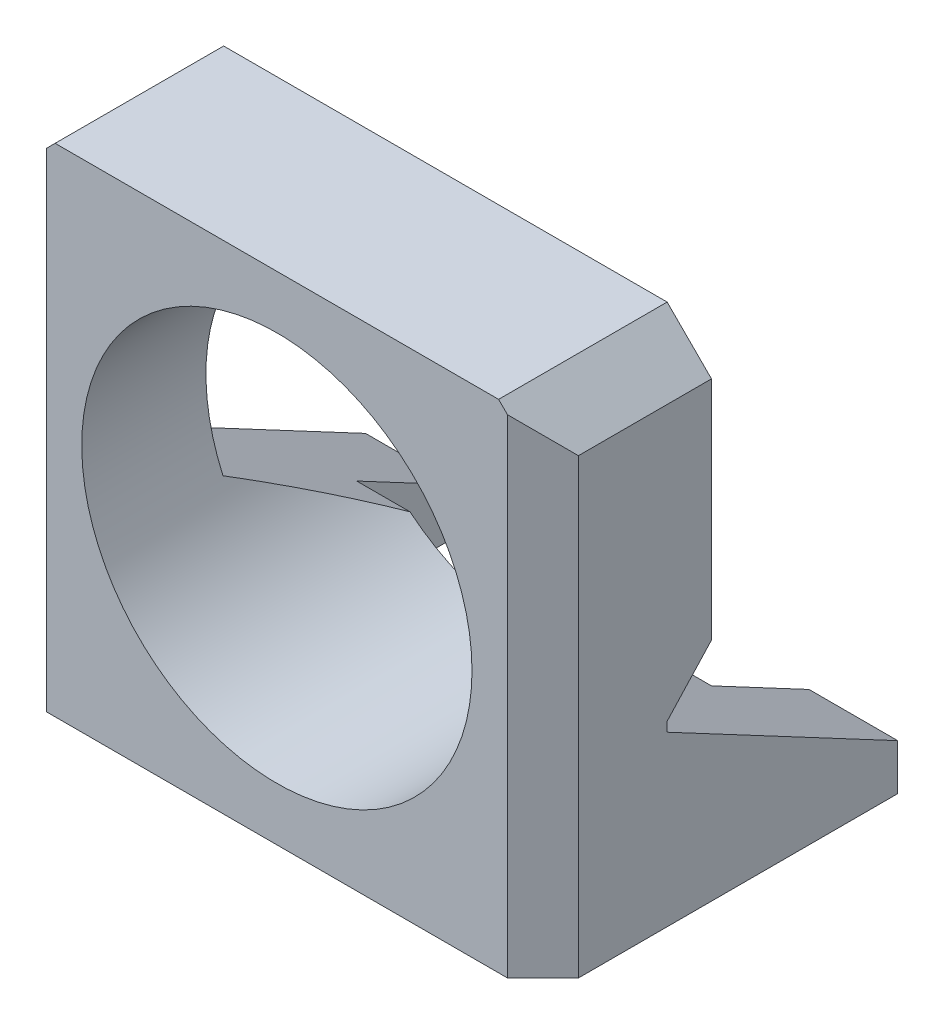
from build123d import *

# Parameters (mm, degrees)
SKETCH1_R           = 11
BOSS_EXTRUDE1_DEPTH = 7
SKETCH2_W           = 5
SKETCH2_H           = 2.5
BOSS_EXTRUDE2_DEPTH = 13
CHAMFER2_SIZE       = 2
BOSS_EXTRUDE6_DEPTH = 2.5
CHAMFER3_SIZE       = 2
CHAMFER4_SIZE       = 2
BOSS_EXTRUDE4_DEPTH = 2.5
CHAMFER6_SIZE       = 2.5
CHAMFER7_SIZE       = 7
CHAMFER7_SIZE_2     = 13.165085257


with BuildPart() as part:
    # Sketch1 → Boss-Extrude1 (new body)
    with BuildSketch(Plane.XY):
        Polygon((-15, 11.5), (-12.5, 14), (12.5, 14), (15, 11.5), (15, -14), (-15, -14), align=None)
        Circle(SKETCH1_R, mode=Mode.SUBTRACT)
    extrude(amount=BOSS_EXTRUDE1_DEPTH)

    # Sketch2 → Boss-Extrude2 (add)
    with BuildSketch(Plane(origin=(0, 0, 0), x_dir=(-1, 0, 0), z_dir=(0, 0, -1))):
        with Locations((-12.5, -12.75)):
            Rectangle(SKETCH2_W, SKETCH2_H)
        with Locations((12.5, -12.75)):
            Rectangle(SKETCH2_W, SKETCH2_H)
    extrude(amount=BOSS_EXTRUDE2_DEPTH)

    # Chamfer2
    chamfer2_edges = [part.edges().sort_by_distance(p)[0] for p in [
        (-10, -12.75, 0),
        (10, -12.75, 0),
    ]]
    chamfer(chamfer2_edges, length=CHAMFER2_SIZE)

    # Sketch5 → Boss-Extrude6 (add)
    with BuildSketch(Plane.XZ.offset(14)):
        Polygon((-10, -2), (-10, -7.5), (10, -7.5), (10, -2), (8, 0), (-8, 0), align=None)
    extrude(amount=-BOSS_EXTRUDE6_DEPTH)

    # Chamfer3
    chamfer3_edges = [part.edges().sort_by_distance(p)[0] for p in [
        (15, -1.25, 7),
    ]]
    chamfer(chamfer3_edges, length=CHAMFER3_SIZE)

    # Chamfer4
    chamfer4_edges = [part.edges().sort_by_distance(p)[0] for p in [
        (-15, -1.25, 7),
    ]]
    chamfer(chamfer4_edges, length=CHAMFER4_SIZE)

    # Sketch4 → Boss-Extrude4 (add)
    with BuildSketch(Plane(origin=(0, 0, 0), x_dir=(-1, 0, 0), z_dir=(0, 0, -1))):
        Polygon((-15, -1.25), (15, 11.5), (12.5, 14), (-12.5, 14), (-15, 11.5), align=None)
    extrude(amount=BOSS_EXTRUDE4_DEPTH)

    # Chamfer6
    # the kernel refuses this chamfer: 2.5 mm, written as the material it adds along each edge
    with BuildSketch(Plane(origin=(20.916998416, -3.764724327, 0), x_dir=(-0.39099275668343275, -0.9199829569021947, 0.02749587661058635), z_dir=(-0.9203309184584746, 0.39114064034485174, 0))) as chamfer6_piece_1_section:
        Polygon((CHAMFER6_SIZE * 0.999621916911, -CHAMFER6_SIZE * 0.0274958766106), (-CHAMFER6_SIZE * 0.0274958766106, -CHAMFER6_SIZE * 0.999621916911), (0, 0), align=None)
    chamfer6_piece_1 = extrude(amount=17.214861222, mode=Mode.PRIVATE)
    chamfer6_piece_1 = chamfer6_piece_1 - Plane(origin=(0, 0, -0.830769879), x_dir=(1, 0, 0), z_dir=(0, 0, -1)) * Cylinder(11, 45, mode=Mode.PRIVATE)
    chamfer6_piece_1 = split(chamfer6_piece_1, bisect_by=Plane(origin=(15, -1.305255327, -0.830769879), z_dir=(-1, 0, 0)), keep=Keep.TOP, mode=Mode.PRIVATE)
    add(chamfer6_piece_1)
    with BuildSketch(Plane(origin=(-1.383846422, 5.71313473, 0), x_dir=(-0.39099275668343275, -0.9199829569021946, 0.02749587661058637), z_dir=(-0.9203309184584746, 0.39114064034485174, 0))) as chamfer6_piece_2_section:
        Polygon((CHAMFER6_SIZE * 0.999621916911, -CHAMFER6_SIZE * 0.0274958766106), (-CHAMFER6_SIZE * 0.0274958766106, -CHAMFER6_SIZE * 0.999621916911), (0, 0), align=None)
    chamfer6_piece_2 = extrude(amount=21.224052785, mode=Mode.PRIVATE)
    chamfer6_piece_2 = chamfer6_piece_2 - Plane(origin=(0, 0, -0.851096237), x_dir=(1, 0, 0), z_dir=(0, 0, -1)) * Cylinder(11, 53, mode=Mode.PRIVATE)
    chamfer6_piece_2 = split(chamfer6_piece_2, bisect_by=Plane(origin=(-15, 9.126408424, -0.851096237), z_dir=(1, 0, 0)), keep=Keep.TOP, mode=Mode.PRIVATE)
    add(chamfer6_piece_2)

    # Chamfer7
    # the kernel refuses this chamfer: 13.165085257, 7 mm, written as the material it adds along each edge
    with BuildSketch(Plane(origin=(-15, -11.5, 0), x_dir=(0, 0.9979482451756082, 0.06402577567608186), z_dir=(1, 0, 0))) as chamfer7_piece_1_section:
        Polygon((CHAMFER7_SIZE * 0.997948245176, -CHAMFER7_SIZE * 0.0640257756761), (-CHAMFER7_SIZE_2 * 0.0640257756781, -CHAMFER7_SIZE_2 * 0.997948245208), (0, 0), align=None)
    chamfer7_piece_1 = extrude(amount=30, mode=Mode.PRIVATE)
    chamfer7_piece_1 = chamfer7_piece_1 - Plane(origin=(0, 0, -3.073682767), x_dir=(1, 0, 0), z_dir=(0, 0, -1)) * Cylinder(11, 113, mode=Mode.PRIVATE)
    chamfer7_piece_1 = split(chamfer7_piece_1, bisect_by=Plane(origin=(-12.500128058, -8.887755394, -7.5), z_dir=(0, 0, 1)), keep=Keep.TOP, mode=Mode.PRIVATE)
    chamfer7_piece_1 = split(chamfer7_piece_1, bisect_by=Plane(origin=(-10, -8.887755394, -3.073682767), z_dir=(-1, 0, 0)), keep=Keep.TOP, mode=Mode.PRIVATE)
    add(chamfer7_piece_1)
    with BuildSketch(Plane(origin=(-15, -11.5, 0), x_dir=(0, 0.9979482451756082, 0.06402577567608186), z_dir=(1, 0, 0))) as chamfer7_piece_2_section:
        Polygon((CHAMFER7_SIZE * 0.997948245176, -CHAMFER7_SIZE * 0.0640257756761), (-CHAMFER7_SIZE_2 * 0.0640257756781, -CHAMFER7_SIZE_2 * 0.997948245208), (0, 0), align=None)
    chamfer7_piece_2 = extrude(amount=30, mode=Mode.PRIVATE)
    chamfer7_piece_2 = split(chamfer7_piece_2, bisect_by=Plane(origin=(-12.5, -10.721530873, -7.5), z_dir=(0, 0, -1)), keep=Keep.TOP, mode=Mode.PRIVATE)
    chamfer7_piece_2 = split(chamfer7_piece_2, bisect_by=Plane(origin=(-10, -10.721530873, -9.597564575), z_dir=(-1, 0, 0)), keep=Keep.TOP, mode=Mode.PRIVATE)
    chamfer7_piece_2 = split(chamfer7_piece_2, bisect_by=Plane(origin=(-12.5, -10.721530873, -13), z_dir=(0, 0, 1)), keep=Keep.TOP, mode=Mode.PRIVATE)
    add(chamfer7_piece_2)
    with BuildSketch(Plane(origin=(-15, -11.5, 0), x_dir=(0, 0.9979482451756082, 0.06402577567608186), z_dir=(1, 0, 0))) as chamfer7_piece_3_section:
        Polygon((CHAMFER7_SIZE * 0.997948245176, -CHAMFER7_SIZE * 0.0640257756761), (-CHAMFER7_SIZE_2 * 0.0640257756781, -CHAMFER7_SIZE_2 * 0.997948245208), (0, 0), align=None)
    chamfer7_piece_3 = extrude(amount=30, mode=Mode.PRIVATE)
    chamfer7_piece_3 = chamfer7_piece_3 - Plane(origin=(0, 0, -3.793876077), x_dir=(1, 0, 0), z_dir=(0, 0, -1)) * Cylinder(11, 113, mode=Mode.PRIVATE)
    chamfer7_piece_3 = split(chamfer7_piece_3, bisect_by=Plane(origin=(-9.499486782, -6.598719884, -7.5), z_dir=(0, 0, 1)), keep=Keep.TOP, mode=Mode.PRIVATE)
    chamfer7_piece_3 = split(chamfer7_piece_3, bisect_by=Plane(origin=(10, -6.598719884, -3.793876077), z_dir=(-1, 0, 0)), keep=Keep.TOP, mode=Mode.PRIVATE)
    chamfer7_piece_3 = split(chamfer7_piece_3, bisect_by=Plane(origin=(-10, -6.598719884, -3.793876077), z_dir=(1, 0, 0)), keep=Keep.TOP, mode=Mode.PRIVATE)
    add(chamfer7_piece_3)
    with BuildSketch(Plane(origin=(-15, -11.5, 0), x_dir=(0, 0.9979482451756082, 0.06402577567608186), z_dir=(1, 0, 0))) as chamfer7_piece_4_section:
        Polygon((CHAMFER7_SIZE * 0.997948245176, -CHAMFER7_SIZE * 0.0640257756761), (-CHAMFER7_SIZE_2 * 0.0640257756781, -CHAMFER7_SIZE_2 * 0.997948245208), (0, 0), align=None)
    chamfer7_piece_4 = extrude(amount=30, mode=Mode.PRIVATE)
    chamfer7_piece_4 = split(chamfer7_piece_4, bisect_by=Plane(origin=(12.5, -10.721530873, -7.5), z_dir=(0, 0, -1)), keep=Keep.TOP, mode=Mode.PRIVATE)
    chamfer7_piece_4 = split(chamfer7_piece_4, bisect_by=Plane(origin=(10, -10.721530873, -9.597564575), z_dir=(1, 0, 0)), keep=Keep.TOP, mode=Mode.PRIVATE)
    chamfer7_piece_4 = split(chamfer7_piece_4, bisect_by=Plane(origin=(12.5, -10.721530873, -13), z_dir=(0, 0, 1)), keep=Keep.TOP, mode=Mode.PRIVATE)
    add(chamfer7_piece_4)
    with BuildSketch(Plane(origin=(-15, -11.5, 0), x_dir=(0, 0.9979482451756082, 0.06402577567608186), z_dir=(1, 0, 0))) as chamfer7_piece_5_section:
        Polygon((CHAMFER7_SIZE * 0.997948245176, -CHAMFER7_SIZE * 0.0640257756761), (-CHAMFER7_SIZE_2 * 0.0640257756781, -CHAMFER7_SIZE_2 * 0.997948245208), (0, 0), align=None)
    chamfer7_piece_5 = extrude(amount=30, mode=Mode.PRIVATE)
    chamfer7_piece_5 = chamfer7_piece_5 - Plane(origin=(0, 0, -3.073682766), x_dir=(1, 0, 0), z_dir=(0, 0, -1)) * Cylinder(11, 113, mode=Mode.PRIVATE)
    chamfer7_piece_5 = split(chamfer7_piece_5, bisect_by=Plane(origin=(12.500128057, -8.887755394, -7.5), z_dir=(0, 0, 1)), keep=Keep.TOP, mode=Mode.PRIVATE)
    chamfer7_piece_5 = split(chamfer7_piece_5, bisect_by=Plane(origin=(10, -8.887755394, -3.073682766), z_dir=(1, 0, 0)), keep=Keep.TOP, mode=Mode.PRIVATE)
    add(chamfer7_piece_5)


solid = part.part
